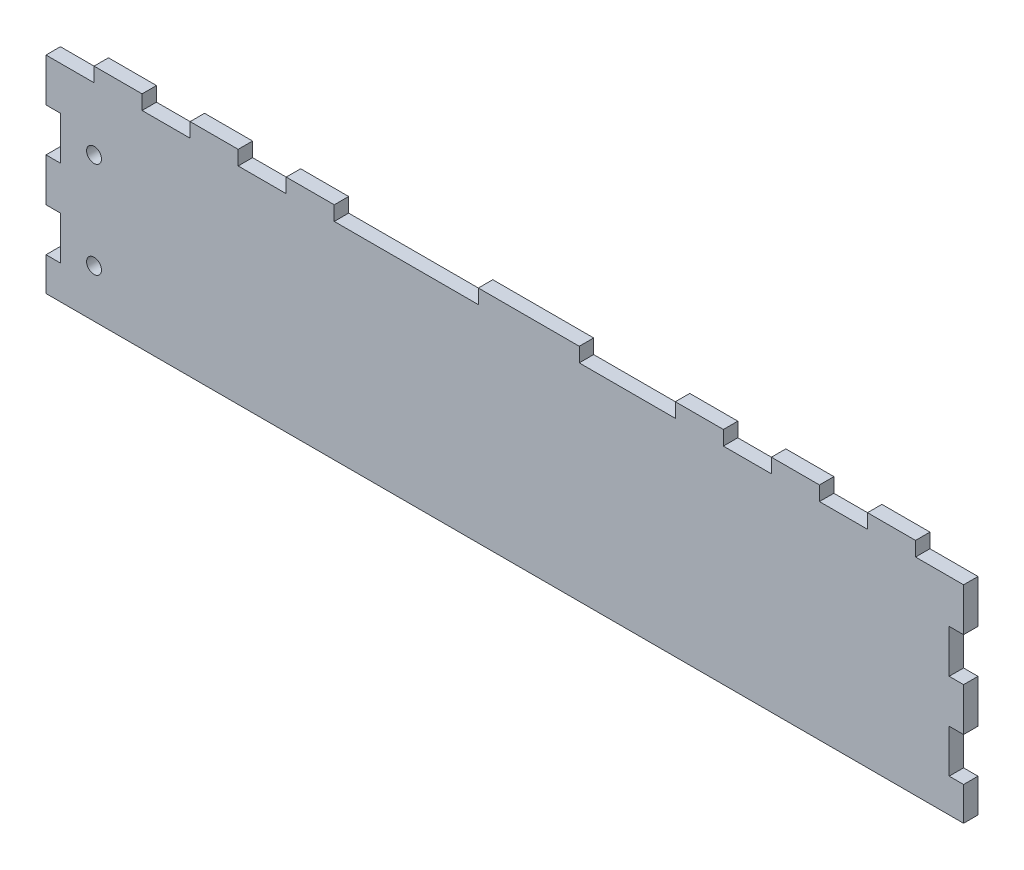
from build123d import *

# Parameters (mm, degrees)
SKETCH1_W           = 191
SKETCH1_H           = 46
SKETCH1_R           = 1.549999948
BOSS_EXTRUDE1_DEPTH = 3
CUT_EXTRUDE1_REACH  = 198.484
SKETCH3_W           = 10
SKETCH3_H           = 3
SKETCH3_W_2         = 30
SKETCH3_W_3         = 20
CUT_EXTRUDE2_REACH  = 198.484
SKETCH4_W           = 3
SKETCH4_H           = 9


with BuildPart() as part:
    # Sketch1 → Boss-Extrude1 (new body)
    with BuildSketch(Plane.XY):
        with Locations((-95.5, 23)):
            Rectangle(SKETCH1_W, SKETCH1_H)
        with Locations((-181, 30)):
            Circle(SKETCH1_R, mode=Mode.SUBTRACT)
        with Locations((-181, 10)):
            Circle(SKETCH1_R, mode=Mode.SUBTRACT)
    extrude(amount=BOSS_EXTRUDE1_DEPTH)

    # Sketch3 → Cut-Extrude1 (cut, up to next)
    with BuildSketch(Plane(origin=(0, 0, 0), x_dir=(-1, 0, 0), z_dir=(0, 0, -1)), mode=Mode.PRIVATE) as cut_extrude1_sk1:
        with Locations((45, 44.5)):
            Rectangle(SKETCH3_W, SKETCH3_H)
    cut_extrude1_tool1 = extrude(cut_extrude1_sk1.sketch, amount=-CUT_EXTRUDE1_REACH, mode=Mode.PRIVATE) & part.part
    # Sketch3 → Cut-Extrude1 (cut, up to next)
    with BuildSketch(Plane(origin=(0, 0, 0), x_dir=(-1, 0, 0), z_dir=(0, 0, -1)), mode=Mode.PRIVATE) as cut_extrude1_sk2:
        with Locations((25, 44.5)):
            Rectangle(SKETCH3_W, SKETCH3_H)
    cut_extrude1_tool2 = extrude(cut_extrude1_sk2.sketch, amount=-CUT_EXTRUDE1_REACH, mode=Mode.PRIVATE) & part.part
    # Sketch3 → Cut-Extrude1 (cut, up to next)
    with BuildSketch(Plane(origin=(0, 0, 0), x_dir=(-1, 0, 0), z_dir=(0, 0, -1)), mode=Mode.PRIVATE) as cut_extrude1_sk3:
        with Locations((5, 44.5)):
            Rectangle(SKETCH3_W, SKETCH3_H)
    cut_extrude1_tool3 = extrude(cut_extrude1_sk3.sketch, amount=-CUT_EXTRUDE1_REACH, mode=Mode.PRIVATE) & part.part
    # Sketch3 → Cut-Extrude1 (cut, up to next)
    with BuildSketch(Plane(origin=(0, 0, 0), x_dir=(-1, 0, 0), z_dir=(0, 0, -1)), mode=Mode.PRIVATE) as cut_extrude1_sk4:
        with Locations((166, 44.5)):
            Rectangle(SKETCH3_W, SKETCH3_H)
    cut_extrude1_tool4 = extrude(cut_extrude1_sk4.sketch, amount=-CUT_EXTRUDE1_REACH, mode=Mode.PRIVATE) & part.part
    # Sketch3 → Cut-Extrude1 (cut, up to next)
    with BuildSketch(Plane(origin=(0, 0, 0), x_dir=(-1, 0, 0), z_dir=(0, 0, -1)), mode=Mode.PRIVATE) as cut_extrude1_sk5:
        with Locations((146, 44.5)):
            Rectangle(SKETCH3_W, SKETCH3_H)
    cut_extrude1_tool5 = extrude(cut_extrude1_sk5.sketch, amount=-CUT_EXTRUDE1_REACH, mode=Mode.PRIVATE) & part.part
    # Sketch3 → Cut-Extrude1 (cut, up to next)
    with BuildSketch(Plane(origin=(0, 0, 0), x_dir=(-1, 0, 0), z_dir=(0, 0, -1)), mode=Mode.PRIVATE) as cut_extrude1_sk6:
        with Locations((116, 44.5)):
            Rectangle(SKETCH3_W_2, SKETCH3_H)
    cut_extrude1_tool6 = extrude(cut_extrude1_sk6.sketch, amount=-CUT_EXTRUDE1_REACH, mode=Mode.PRIVATE) & part.part
    # Sketch3 → Cut-Extrude1 (cut, up to next)
    with BuildSketch(Plane(origin=(0, 0, 0), x_dir=(-1, 0, 0), z_dir=(0, 0, -1)), mode=Mode.PRIVATE) as cut_extrude1_sk7:
        with Locations((70, 44.5)):
            Rectangle(SKETCH3_W_3, SKETCH3_H)
    cut_extrude1_tool7 = extrude(cut_extrude1_sk7.sketch, amount=-CUT_EXTRUDE1_REACH, mode=Mode.PRIVATE) & part.part
    # Sketch3 → Cut-Extrude1 (cut, up to next)
    with BuildSketch(Plane(origin=(0, 0, 0), x_dir=(-1, 0, 0), z_dir=(0, 0, -1)), mode=Mode.PRIVATE) as cut_extrude1_sk8:
        with Locations((186, 44.5)):
            Rectangle(SKETCH3_W, SKETCH3_H)
    cut_extrude1_tool8 = extrude(cut_extrude1_sk8.sketch, amount=-CUT_EXTRUDE1_REACH, mode=Mode.PRIVATE) & part.part
    add(cut_extrude1_tool1.solids().sort_by_distance((-45, 44.5, 0))[0], mode=Mode.SUBTRACT)
    add(cut_extrude1_tool2.solids().sort_by_distance((-25, 44.5, 0))[0], mode=Mode.SUBTRACT)
    add(cut_extrude1_tool3.solids().sort_by_distance((-5, 44.5, 0))[0], mode=Mode.SUBTRACT)
    add(cut_extrude1_tool4.solids().sort_by_distance((-166, 44.5, 0))[0], mode=Mode.SUBTRACT)
    add(cut_extrude1_tool5.solids().sort_by_distance((-146, 44.5, 0))[0], mode=Mode.SUBTRACT)
    add(cut_extrude1_tool6.solids().sort_by_distance((-116, 44.5, 0))[0], mode=Mode.SUBTRACT)
    add(cut_extrude1_tool7.solids().sort_by_distance((-70, 44.5, 0))[0], mode=Mode.SUBTRACT)
    add(cut_extrude1_tool8.solids().sort_by_distance((-186, 44.5, 0))[0], mode=Mode.SUBTRACT)

    # Sketch4 → Cut-Extrude2 (cut, up to next)
    with BuildSketch(Plane.XY.offset(3), mode=Mode.PRIVATE) as cut_extrude2_sk1:
        with Locations((-1.5, 29.5)):
            Rectangle(SKETCH4_W, SKETCH4_H)
    cut_extrude2_tool1 = extrude(cut_extrude2_sk1.sketch, amount=-CUT_EXTRUDE2_REACH, mode=Mode.PRIVATE) & part.part
    # Sketch4 → Cut-Extrude2 (cut, up to next)
    with BuildSketch(Plane.XY.offset(3), mode=Mode.PRIVATE) as cut_extrude2_sk2:
        with Locations((-1.5, 11.5)):
            Rectangle(SKETCH4_W, SKETCH4_H)
    cut_extrude2_tool2 = extrude(cut_extrude2_sk2.sketch, amount=-CUT_EXTRUDE2_REACH, mode=Mode.PRIVATE) & part.part
    cut_extrude2_1 = cut_extrude2_tool1.solids().sort_by_distance((-1.5, 29.5, 3))[0]
    add(cut_extrude2_1, mode=Mode.SUBTRACT)
    cut_extrude2_2 = cut_extrude2_tool2.solids().sort_by_distance((-1.5, 11.5, 3))[0]
    add(cut_extrude2_2, mode=Mode.SUBTRACT)
    cut_extrude2 = cut_extrude2_1 + cut_extrude2_2  # Cut-Extrude2 as one shape, for the pattern or mirror that repeats it

    # Mirror1: Cut-Extrude2 across plane
    add(cut_extrude2.mirror(Plane(origin=(-95.5, 0, 0), x_dir=(0, 0, 1), z_dir=(1, 0, 0))), mode=Mode.SUBTRACT)


solid = part.part
